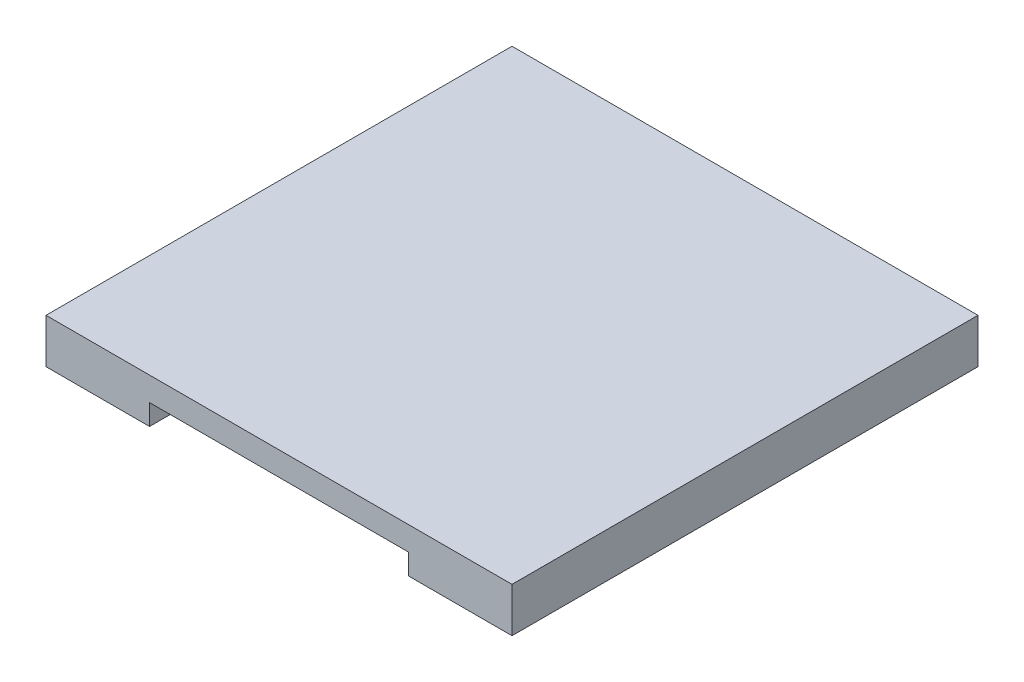
from build123d import *
from OCP.BRepFilletAPI import BRepFilletAPI_MakeChamfer

# Parameters (mm, degrees)
ESQUISSE2_W             = 90
ESQUISSE2_H             = 90
BOSS_EXTRU_1_DEPTH      = 4
ESQUISSE3_W             = 9.2
ESQUISSE3_H             = 10.3
BOSS_EXTRU_2_DEPTH      = 2.4
CONG_1_R                = 1
ESQUISSE5_W             = 14.85
ESQUISSE5_H             = 90
BOSS_EXTRU_3_DEPTH      = 2.4
ESQUISSE6_W             = 7
ESQUISSE6_H             = 5
BOSS_EXTRU_4_DEPTH      = 38
ESQUISSE8_W             = 14.85
ESQUISSE8_H             = 18
BOSS_EXTRU_5_DEPTH      = 38
BOSS_EXTRU_6_REACH      = 97.814
ESQUISSE9_W             = 7
ESQUISSE9_H             = 2
CONG_1_OF_SYM_TRIE1_R   = 1
ENL_V_MAT_EXTRU_1_REACH = 111.983
ESQUISSE10_W            = 2
ESQUISSE10_H            = 18
ENL_V_MAT_EXTRU_2_REACH = 77.38
ESQUISSE11_W            = 40
ESQUISSE11_H            = 18
BOSS_EXTRU_7_REACH      = 100.203
ESQUISSE12_W            = 5
ESQUISSE12_H            = 8.6
ESQUISSE13_W            = 6.9
ESQUISSE13_H            = 7.6
BOSS_EXTRU_8_DEPTH      = 2.45
CONG_2_R                = 1
CONG_2_OF_SYM_TRIE2_R   = 1
BOSS_EXTRU_9_DEPTH      = 3
BOSS_EXTRU_9_DEPTH_BACK = 3
ESQUISSE14_W            = 90
ESQUISSE14_H            = 17.8
ESQUISSE15_W            = 15
ESQUISSE15_H            = 17.8
BOSS_EXTRU_10_DEPTH     = 44
ESQUISSE16_W            = 90
ESQUISSE16_H            = 90
BOSS_EXTRU_11_DEPTH     = 8.6
ESQUISSE20_W            = 12
ESQUISSE20_H            = 6.4
BOSS_EXTRU_13_DEPTH     = 10
ESQUISSE21_W            = 12
ESQUISSE21_H            = 6.4
BOSS_EXTRU_14_DEPTH     = 10
CONG_3_R                = 6
ENL_V_MAT_EXTRU_4_REACH = 123.7
ESQUISSE23_R            = 2.3
CONG_3_OF_SYM_TRIE3_R   = 6
ENL_V_MAT_EXTRU_5_REACH = 123.7
ESQUISSE24_R            = 1.75
ENL_V_MAT_EXTRU_6_REACH = 135.65
ESQUISSE26_R            = 1.75
ESQUISSE27_W            = 50
ESQUISSE27_H            = 4
ENL_V_MAT_EXTRU_7_DEPTH = 72.2
CHANFREIN3_SIZE         = 28.5
CHANFREIN3_SIZE2        = 9.5
CHANFREIN4_SIZE         = 10
CHANFREIN4_SIZE2        = 17.5
CHANFREIN8_START        = -45
CHANFREIN8_DEPTH        = 17.8
CHANFREIN9_SIZE         = 3
CHANFREIN9_SIZE_2       = 9
CHANFREIN10_START       = 25.930676813
CHANFREIN10_OUTLINE_W   = 40
CHANFREIN10_OUTLINE_H   = 3.16227766
CHANFREIN10_DEPTH       = 2.069323187
CONG_9_R                = 3
ESQUISSE37_R            = 4
ENL_V_MAT_EXTRU_8_DEPTH = 3
BOSS_EXTRU_15_DEPTH     = 4.8
CONG_11_R               = 3
CHANFREIN14_SIZE        = 10
CHANFREIN14_SIZE2       = 5
ESQUISSE39_W            = 110.537037217
ESQUISSE39_H            = 103.424550411
ENL_V_MAT_EXTRU_9_DEPTH = 79
ESQUISSE40_W            = 8.2
ESQUISSE40_H            = 11.3
BOSS_EXTRU_16_DEPTH     = 15


with BuildPart() as part:
    # Esquisse2 → Boss.-Extru.1 (new body)
    with BuildSketch(Plane(origin=(0, 0, 0), x_dir=(1, 0, 0), z_dir=(0, 1, 0))):
        Rectangle(ESQUISSE2_W, ESQUISSE2_H)
    extrude(amount=BOSS_EXTRU_1_DEPTH)

    # Esquisse3 → Boss.-Extru.2 (add)
    with BuildSketch(Plane(origin=(0, 4, 0), x_dir=(1, 0, 0), z_dir=(0, 1, 0))):
        with Locations((25.55, -6)):
            Rectangle(ESQUISSE3_W, ESQUISSE3_H)
    boss_extru_2 = extrude(amount=BOSS_EXTRU_2_DEPTH)

    # Congé1
    cong_1_edges = [part.edges().sort_by_distance(p)[0] for p in [
        (20.95, 5.2, 0.85),
        (20.95, 5.2, 11.15),
    ]]
    fillet(cong_1_edges, radius=CONG_1_R)

    # Esquisse5 → Boss.-Extru.3 (add)
    with BuildSketch(Plane(origin=(0, 4, 0), x_dir=(1, 0, 0), z_dir=(0, 1, 0))):
        with Locations((37.575, 0)):
            Rectangle(ESQUISSE5_W, ESQUISSE5_H)
    boss_extru_3 = extrude(amount=BOSS_EXTRU_3_DEPTH)

    # Esquisse6 → Boss.-Extru.4 (add)
    with BuildSketch(Plane(origin=(0, 6.4, 0), x_dir=(1, 0, 0), z_dir=(0, 1, 0))):
        with Locations((33.65, -42.5)):
            Rectangle(ESQUISSE6_W, ESQUISSE6_H)
    boss_extru_4 = extrude(amount=BOSS_EXTRU_4_DEPTH)

    # Esquisse8 → Boss.-Extru.5 (add)
    with BuildSketch(Plane(origin=(0, 6.4, 0), x_dir=(1, 0, 0), z_dir=(0, 1, 0))):
        with Locations((37.575, 36)):
            Rectangle(ESQUISSE8_W, ESQUISSE8_H)
    boss_extru_5 = extrude(amount=BOSS_EXTRU_5_DEPTH)

    # Esquisse9 → Boss.-Extru.6 (add, up to next)
    with BuildSketch(Plane.XY.offset(-27), mode=Mode.PRIVATE) as boss_extru_6_sk1:
        with Locations((33.65, 43.4)):
            Rectangle(ESQUISSE9_W, ESQUISSE9_H)
    boss_extru_6_tool1 = extrude(boss_extru_6_sk1.sketch, amount=BOSS_EXTRU_6_REACH, mode=Mode.PRIVATE) - part.part
    boss_extru_6 = boss_extru_6_tool1.solids().sort_by_distance((33.65, 43.4, -27))[0]
    add(boss_extru_6)

    # Symétrie1: Boss.-Extru.2, Boss.-Extru.3, Boss.-Extru.4, Boss.-Extru.5, Boss.-Extru.6 across plane
    add(boss_extru_2.mirror(Plane(origin=(0, 0, 0), x_dir=(0, 0, 1), z_dir=(1, 0, 0))))
    add(boss_extru_3.mirror(Plane(origin=(0, 0, 0), x_dir=(0, 0, 1), z_dir=(1, 0, 0))))
    add(boss_extru_4.mirror(Plane(origin=(0, 0, 0), x_dir=(0, 0, 1), z_dir=(1, 0, 0))))
    add(boss_extru_5.mirror(Plane(origin=(0, 0, 0), x_dir=(0, 0, 1), z_dir=(1, 0, 0))))
    add(boss_extru_6.mirror(Plane(origin=(0, 0, 0), x_dir=(0, 0, 1), z_dir=(1, 0, 0))))

    # Congé1 of Symétrie1
    cong_1_of_sym_trie1_edges = [part.edges().sort_by_distance(p)[0] for p in [
        (-20.95, 5.2, 0.85),
        (-20.95, 5.2, 11.15),
    ]]
    fillet(cong_1_of_sym_trie1_edges, radius=CONG_1_OF_SYM_TRIE1_R)

    # Esquisse10 → Enlèv. mat.-Extru.1 (cut, up to next)
    with BuildSketch(Plane.XY.offset(45), mode=Mode.PRIVATE) as enl_v_mat_extru_1_sk1:
        with Locations((-31.15, 26.85)):
            Rectangle(ESQUISSE10_W, ESQUISSE10_H)
    enl_v_mat_extru_1_tool1 = extrude(enl_v_mat_extru_1_sk1.sketch, amount=-ENL_V_MAT_EXTRU_1_REACH, mode=Mode.PRIVATE) & part.part
    add(enl_v_mat_extru_1_tool1.solids().sort_by_distance((-31.15, 26.85, 45))[0], mode=Mode.SUBTRACT)

    # Esquisse11 → Enlèv. mat.-Extru.2 (cut, up to next)
    with BuildSketch(Plane(origin=(0, 4, 0), x_dir=(1, 0, 0), z_dir=(0, 1, 0)), mode=Mode.PRIVATE) as enl_v_mat_extru_2_sk1:
        with Locations((0, 36)):
            Rectangle(ESQUISSE11_W, ESQUISSE11_H)
    enl_v_mat_extru_2_tool1 = extrude(enl_v_mat_extru_2_sk1.sketch, amount=-ENL_V_MAT_EXTRU_2_REACH, mode=Mode.PRIVATE) & part.part
    add(enl_v_mat_extru_2_tool1.solids().sort_by_distance((0, 4, -36))[0], mode=Mode.SUBTRACT)

    # Esquisse12 → Boss.-Extru.7 (add, up to next)
    with BuildSketch(Plane(origin=(-30.15, 0, 0), x_dir=(0, 0, -1), z_dir=(1, 0, 0)), mode=Mode.PRIVATE) as boss_extru_7_sk1:
        with Locations((29.5, 29.34)):
            Rectangle(ESQUISSE12_W, ESQUISSE12_H)
    boss_extru_7_tool1 = extrude(boss_extru_7_sk1.sketch, amount=BOSS_EXTRU_7_REACH, mode=Mode.PRIVATE) - part.part
    add(boss_extru_7_tool1.solids().sort_by_distance((-30.15, 29.34, -29.5))[0])

    # Esquisse13 → Boss.-Extru.8 (add)
    with BuildSketch(Plane.XY.offset(-27)):
        with Locations((24.4, 29.84)):
            Rectangle(ESQUISSE13_W, ESQUISSE13_H)
    boss_extru_8 = extrude(amount=BOSS_EXTRU_8_DEPTH)

    # Congé2
    cong_2_edges = [part.edges().sort_by_distance(p)[0] for p in [
        (20.95, 33.64, -25.775),
        (20.95, 26.04, -25.775),
    ]]
    fillet(cong_2_edges, radius=CONG_2_R)

    # Symétrie2: Boss.-Extru.8 across plane
    add(boss_extru_8.mirror(Plane(origin=(0, 0, 0), x_dir=(0, 0, 1), z_dir=(1, 0, 0))))

    # Congé2 of Symétrie2
    cong_2_of_sym_trie2_edges = [part.edges().sort_by_distance(p)[0] for p in [
        (-20.95, 33.64, -25.775),
        (-20.95, 26.04, -25.775),
    ]]
    fillet(cong_2_of_sym_trie2_edges, radius=CONG_2_OF_SYM_TRIE2_R)

    # Esquisse14 → Boss.-Extru.9 (add, two sides: drawn at the far end of the back side and taken through both)
    with BuildSketch(Plane(origin=(0, 44.4, 0), x_dir=(1, 0, 0), z_dir=(0, 1, 0)).offset(-BOSS_EXTRU_9_DEPTH_BACK)):
        with Locations((0, 36.1)):
            Rectangle(ESQUISSE14_W, ESQUISSE14_H)
    extrude(amount=BOSS_EXTRU_9_DEPTH + BOSS_EXTRU_9_DEPTH_BACK)

    # Esquisse15 → Boss.-Extru.10 (add)
    with BuildSketch(Plane(origin=(0, 47.4, 0), x_dir=(1, 0, 0), z_dir=(0, 1, 0))):
        with Locations((0, 36.1)):
            Rectangle(ESQUISSE15_W, ESQUISSE15_H)
    extrude(amount=BOSS_EXTRU_10_DEPTH)

    # Esquisse16 → Boss.-Extru.11 (add)
    with BuildSketch(Plane(origin=(0, 91.4, 0), x_dir=(1, 0, 0), z_dir=(0, 1, 0))):
        Rectangle(ESQUISSE16_W, ESQUISSE16_H)
    extrude(amount=BOSS_EXTRU_11_DEPTH)

    # Esquisse20 → Boss.-Extru.13 (add)
    with BuildSketch(Plane(origin=(45, 0, 0), x_dir=(0, 0, -1), z_dir=(1, 0, 0))):
        with Locations((-11, 3.2)):
            Rectangle(ESQUISSE20_W, ESQUISSE20_H)
    boss_extru_13 = extrude(amount=BOSS_EXTRU_13_DEPTH)

    # Esquisse21 → Boss.-Extru.14 (add)
    with BuildSketch(Plane(origin=(0, 0, -45), x_dir=(-1, 0, 0), z_dir=(0, 0, -1))):
        with Locations((-39, 3.2)):
            Rectangle(ESQUISSE21_W, ESQUISSE21_H)
    boss_extru_14 = extrude(amount=BOSS_EXTRU_14_DEPTH)

    # Congé3
    cong_3_edges = [part.edges().sort_by_distance(p)[0] for p in [
        (33, 3.2, -55),
        (45, 3.2, -55),
        (55, 3.2, 5),
        (55, 3.2, 17),
    ]]
    fillet(cong_3_edges, radius=CONG_3_R - 0.0001)  # a hair under: the kernel refuses the full size

    # Esquisse23 → Enlèv. mat.-Extru.4 (cut, up to next)
    with BuildSketch(Plane(origin=(0, 6.4, 0), x_dir=(1, 0, 0), z_dir=(0, 1, 0)), mode=Mode.PRIVATE) as enl_v_mat_extru_4_sk1:
        with Locations(Location((50, -11, 0), (0, 0, 270))):
            Circle(ESQUISSE23_R)
    enl_v_mat_extru_4_tool1 = extrude(enl_v_mat_extru_4_sk1.sketch, amount=-ENL_V_MAT_EXTRU_4_REACH, mode=Mode.PRIVATE) & part.part
    # Esquisse23 → Enlèv. mat.-Extru.4 (cut, up to next)
    with BuildSketch(Plane(origin=(0, 6.4, 0), x_dir=(1, 0, 0), z_dir=(0, 1, 0)), mode=Mode.PRIVATE) as enl_v_mat_extru_4_sk2:
        with Locations(Location((39, 50, 0), (0, 0, 270))):
            Circle(ESQUISSE23_R)
    enl_v_mat_extru_4_tool2 = extrude(enl_v_mat_extru_4_sk2.sketch, amount=-ENL_V_MAT_EXTRU_4_REACH, mode=Mode.PRIVATE) & part.part
    enl_v_mat_extru_4_1 = enl_v_mat_extru_4_tool1.solids().sort_by_distance((50, 6.4, 11))[0]
    add(enl_v_mat_extru_4_1, mode=Mode.SUBTRACT)
    enl_v_mat_extru_4_2 = enl_v_mat_extru_4_tool2.solids().sort_by_distance((39, 6.4, -50))[0]
    add(enl_v_mat_extru_4_2, mode=Mode.SUBTRACT)
    enl_v_mat_extru_4 = enl_v_mat_extru_4_1 + enl_v_mat_extru_4_2  # Enlèv. mat.-Extru.4 as one shape, for the pattern or mirror that repeats it

    # Symétrie3: Boss.-Extru.13, Boss.-Extru.14, Enlèv. mat.-Extru.4 across plane
    add(boss_extru_13.mirror(Plane(origin=(0, 0, 0), x_dir=(0, 0, 1), z_dir=(1, 0, 0))))
    add(boss_extru_14.mirror(Plane(origin=(0, 0, 0), x_dir=(0, 0, 1), z_dir=(1, 0, 0))))
    add(enl_v_mat_extru_4.mirror(Plane(origin=(0, 0, 0), x_dir=(0, 0, 1), z_dir=(1, 0, 0))), mode=Mode.SUBTRACT)

    # Congé3 of Symétrie3
    cong_3_of_sym_trie3_edges = [part.edges().sort_by_distance(p)[0] for p in [
        (-33, 3.2, -55),
        (-45, 3.2, -55),
        (-55, 3.2, 5),
        (-55, 3.2, 17),
    ]]
    fillet(cong_3_of_sym_trie3_edges, radius=CONG_3_OF_SYM_TRIE3_R - 0.0001)  # a hair under: the kernel refuses the full size

    # Esquisse24 → Enlèv. mat.-Extru.5 (cut, up to next)
    with BuildSketch(Plane(origin=(0, 6.4, 0), x_dir=(1, 0, 0), z_dir=(0, 1, 0)), mode=Mode.PRIVATE) as enl_v_mat_extru_5_sk1:
        with Locations(Location((25.45, -6, 0), (0, 0, 270))):
            Circle(ESQUISSE24_R)
    enl_v_mat_extru_5_tool1 = extrude(enl_v_mat_extru_5_sk1.sketch, amount=-ENL_V_MAT_EXTRU_5_REACH, mode=Mode.PRIVATE) & part.part
    enl_v_mat_extru_5 = enl_v_mat_extru_5_tool1.solids().sort_by_distance((25.45, 6.4, 6))[0]
    add(enl_v_mat_extru_5, mode=Mode.SUBTRACT)

    # Esquisse26 → Enlèv. mat.-Extru.6 (cut, up to next)
    with BuildSketch(Plane.XY.offset(-24.55), mode=Mode.PRIVATE) as enl_v_mat_extru_6_sk1:
        with Locations((25.55, 28.44)):
            Circle(ESQUISSE26_R)
    enl_v_mat_extru_6_tool1 = extrude(enl_v_mat_extru_6_sk1.sketch, amount=-ENL_V_MAT_EXTRU_6_REACH, mode=Mode.PRIVATE) & part.part
    enl_v_mat_extru_6 = enl_v_mat_extru_6_tool1.solids().sort_by_distance((25.55, 28.44, -24.55))[0]
    add(enl_v_mat_extru_6, mode=Mode.SUBTRACT)

    # Symétrie5: Enlèv. mat.-Extru.5, Enlèv. mat.-Extru.6 across plane
    add(enl_v_mat_extru_5.mirror(Plane(origin=(0, 0, 0), x_dir=(0, 0, 1), z_dir=(1, 0, 0))), mode=Mode.SUBTRACT)
    add(enl_v_mat_extru_6.mirror(Plane(origin=(0, 0, 0), x_dir=(0, 0, 1), z_dir=(1, 0, 0))), mode=Mode.SUBTRACT)

    # Esquisse27 → Enlèv. mat.-Extru.7 (cut)
    with BuildSketch(Plane.XY.offset(45)):
        with Locations((0, 93.4)):
            Rectangle(ESQUISSE27_W, ESQUISSE27_H)
    extrude(amount=-ENL_V_MAT_EXTRU_7_DEPTH, mode=Mode.SUBTRACT)

    # Chanfrein3: one chamfer whose edges measure the first distance from different faces: ONE call of the kernel's chamfer builder (chamfer() names one face for all edges)
    chanfrein3_edges_1 = [part.edges().sort_by_distance(p)[0] for p in [
        (-7.5, 47.4, -36.1),
    ]]
    chanfrein3_side_1 = [part.faces().sort_by_distance(p)[0] for p in [
        (-26.25, 47.4, -36.1),
    ]]
    chanfrein3_edges_2 = [part.edges().sort_by_distance(p)[0] for p in [
        (7.5, 47.4, -36.1),
    ]]
    chanfrein3_side_2 = [part.faces().sort_by_distance(p)[0] for p in [
        (26.25, 47.4, -36.1),
    ]]
    chanfrein3 = BRepFilletAPI_MakeChamfer(part.part.solid().wrapped)
    for e in chanfrein3_edges_1:
        chanfrein3.Add(CHANFREIN3_SIZE, CHANFREIN3_SIZE2, e.wrapped, chanfrein3_side_1[0].wrapped)  # the first distance lies on this face
    for e in chanfrein3_edges_2:
        chanfrein3.Add(CHANFREIN3_SIZE, CHANFREIN3_SIZE2, e.wrapped, chanfrein3_side_2[0].wrapped)  # the first distance lies on this face
    add(Compound.cast(chanfrein3.Shape()), mode=Mode.REPLACE)

    # Chanfrein4: one chamfer whose edges measure the first distance from different faces: ONE call of the kernel's chamfer builder (chamfer() names one face for all edges)
    chanfrein4_edges_1 = [part.edges().sort_by_distance(p)[0] for p in [
        (7.5, 91.4, -36.1),
    ]]
    chanfrein4_side_1 = [part.faces().sort_by_distance(p)[0] for p in [
        (7.5, 74.15, -36.1),
    ]]
    chanfrein4_edges_2 = [part.edges().sort_by_distance(p)[0] for p in [
        (-7.5, 91.4, -36.1),
    ]]
    chanfrein4_side_2 = [part.faces().sort_by_distance(p)[0] for p in [
        (-7.5, 74.15, -36.1),
    ]]
    chanfrein4 = BRepFilletAPI_MakeChamfer(part.part.solid().wrapped)
    for e in chanfrein4_edges_1:
        chanfrein4.Add(CHANFREIN4_SIZE, CHANFREIN4_SIZE2, e.wrapped, chanfrein4_side_1[0].wrapped)  # the first distance lies on this face
    for e in chanfrein4_edges_2:
        chanfrein4.Add(CHANFREIN4_SIZE, CHANFREIN4_SIZE2, e.wrapped, chanfrein4_side_2[0].wrapped)  # the first distance lies on this face
    add(Compound.cast(chanfrein4.Shape()), mode=Mode.REPLACE)

    # Chanfrein8: read off the stored shape, not the designer's step
    # Chanfrein8 outline → Chanfrein8 (add)
    with BuildSketch(Plane.XY.offset(CHANFREIN8_START)):
        Polygon((30.15, 31.35), (30.15, 41.4), (0, 41.4), align=None)
    extrude(amount=CHANFREIN8_DEPTH)

    # Chanfrein9
    chanfrein9_edges_1 = [part.edges().sort_by_distance(p)[0] for p in [
        (45, 47.4, -36.1),
    ]]
    chanfrein9_side_1 = [part.faces().sort_by_distance(p)[0] for p in [
        (45, 47.34, -36.1),
    ]]
    chanfrein9_edges_2 = [part.edges().sort_by_distance(p)[0] for p in [
        (-45, 47.4, -36.1),
    ]]
    chanfrein9_side_2 = [part.faces().sort_by_distance(p)[0] for p in [
        (-44.94, 47.4, -36.1),
    ]]
    chanfrein9 = BRepFilletAPI_MakeChamfer(part.part.solid().wrapped)
    for e in chanfrein9_edges_1:
        chanfrein9.Add(CHANFREIN9_SIZE - 0.0001, CHANFREIN9_SIZE_2 - 0.0001, e.wrapped, chanfrein9_side_1[0].wrapped)
    for e in chanfrein9_edges_2:
        chanfrein9.Add(CHANFREIN9_SIZE_2 - 0.0001, CHANFREIN9_SIZE - 0.0001, e.wrapped, chanfrein9_side_2[0].wrapped)
    add(Compound.cast(chanfrein9.Shape()), mode=Mode.REPLACE)  # a hair under: the kernel refuses the full size

    # Chanfrein10: read off the stored shape, not the designer's step
    # Chanfrein10 outline → Chanfrein10 (cut)
    with BuildSketch(Plane(origin=(0, 0, 0), x_dir=(1, 0, 0), z_dir=(0, 0.316227766016835, -0.9486832980505149)).offset(CHANFREIN10_START)):
        with Locations((0, 6.008327554)):
            Rectangle(CHANFREIN10_OUTLINE_W, CHANFREIN10_OUTLINE_H)
    extrude(amount=CHANFREIN10_DEPTH, mode=Mode.SUBTRACT)

    # Congé9
    cong_9_edges = [part.edges().sort_by_distance(p)[0] for p in [
        (-33.65, 44.4, 45),
        (-33.65, 6.4, 40),
        (-37.575, 6.4, -27),
        (-33.65, 42.4, 40),
        (-33.65, 42.4, -27),
        (33.65, 6.4, 40),
        (33.65, 44.4, 45),
        (37.575, 6.4, -27),
        (33.65, 42.4, 40),
        (33.65, 42.4, -27),
    ]]
    fillet(cong_9_edges, radius=CONG_9_R)

    # Chanfrein13
    # the kernel refuses this chamfer: 31.5, 10.5 mm, written as the material it adds along each edge
    with BuildSketch(Plane(origin=(-30.15, 41.4, -27.2), x_dir=(0, -1, 0), z_dir=(0, 0, -1))) as chanfrein13_piece_1:
        with BuildLine():
            Line((10.898446985, 1.195340956), (-0.398446985, -32.695340956))
            Line((-0.398446985, -32.695340956), (-1.028446985, -32.695340956))
            ThreePointArc((-1.028446985, -32.695340956), (-0.63, -16.347670478), (-0.63, 0))
            Line((-0.63, 0), (0, 0.63))
            ThreePointArc((0, 0.63), (5.449223493, 0.63), (10.898446985, 1.825340956))
            Line((10.898446985, 1.825340956), (10.898446985, 1.195340956))
        make_face()
    extrude(amount=17.8)

    # Esquisse37 → Enlèv. mat.-Extru.8 (cut)
    with BuildSketch(Plane.XZ):
        with Locations(Location((-25.45, 6, 0), (0, 0, 270))):
            Circle(ESQUISSE37_R)
        with Locations(Location((25.45, 6, 0), (0, 0, 270))):
            Circle(ESQUISSE37_R)
    extrude(amount=-ENL_V_MAT_EXTRU_8_DEPTH, mode=Mode.SUBTRACT)

    # Esquisse38 → Boss.-Extru.15 (add)
    with BuildSketch(Plane.XY.offset(-27.2)):
        Polygon((0.675, 41.175), (-21.95, 33.64), (23.28, 33.64), align=None)
    extrude(amount=-BOSS_EXTRU_15_DEPTH)

    # Congé11
    cong_11_edges = [part.edges().sort_by_distance(p)[0] for p in [
        (7.5, 56.9, -36.1),
        (-7.5, 56.9, -36.1),
        (-25, 91.4, -36.1),
        (-7.5, 81.4, -36.1),
        (25, 91.4, -36.1),
        (7.5, 81.4, -36.1),
        (30.15, 31.35, -38.5),
        (-30.15, 30.9, -38.5),
        (0.675, 41.175, -38.5),
    ]]
    fillet(cong_11_edges, radius=CONG_11_R)

    # Chanfrein14
    chanfrein14_edges = [part.edges().sort_by_distance(p)[0] for p in [
        (0, 95.4, -27.2),
    ]]
    chanfrein14_side = [part.faces().sort_by_distance(p)[0] for p in [
        (0, 95.4, 8.9),
    ]]
    chamfer(chanfrein14_edges, length=CHANFREIN14_SIZE, length2=CHANFREIN14_SIZE2, reference=chanfrein14_side[0])

    # Esquisse39 → Enlèv. mat.-Extru.9 (cut)
    with BuildSketch(Plane.XZ):
        with Locations((-0.268518609, -4.614943927)):
            Rectangle(ESQUISSE39_W, ESQUISSE39_H)
    extrude(amount=-ENL_V_MAT_EXTRU_9_DEPTH, mode=Mode.SUBTRACT)

    # Esquisse40 → Boss.-Extru.16 (add)
    with BuildSketch(Plane.XZ.offset(-79)):
        with Locations((0, -36.1)):
            Rectangle(ESQUISSE40_W, ESQUISSE40_H)
    extrude(amount=BOSS_EXTRU_16_DEPTH)


solid = part.part
